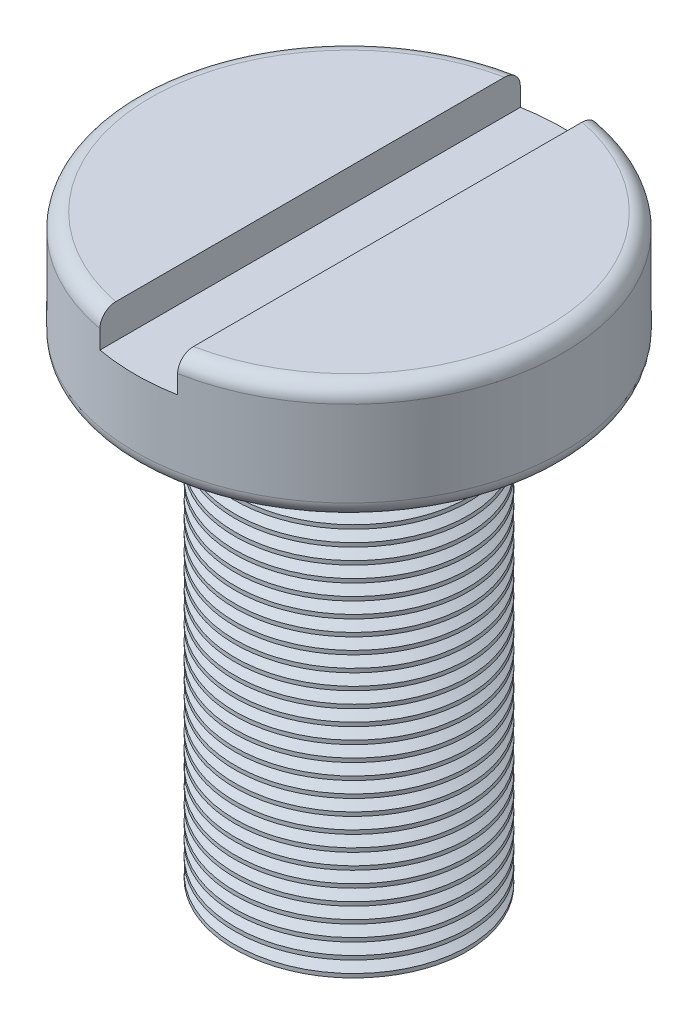
from build123d import *

# Parameters (mm, degrees)
SKETCH1_R           = 2.75
SKETCH1_R_2         = 1.5
BOSS_EXTRUDE1_DEPTH = 1.5
SKETCH1_3_R         = 1.5
BOSS_EXTRUDE2_DEPTH = 6
FILLET1_R           = 0.2
SKETCH3_W           = 7.35917601
SKETCH3_H           = 0.8748089
CUT_EXTRUDE1_DEPTH  = 0.5
CUT_SWEEP1_PITCH    = 0.2


with BuildPart() as part:
    # Sketch1 → Boss-Extrude1 (new body)
    # profile 1 of 2: a face of its own
    with BuildSketch(Plane(origin=(0, 0, 0), x_dir=(1, 0, 0), z_dir=(0, 1, 0))):
        with Locations(Location((0, 0, 0), (0, 0, 270))):
            Circle(SKETCH1_R)
        Circle(SKETCH1_R_2, mode=Mode.SUBTRACT)
    # profile 2 of 2: a face of its own
    with BuildSketch(Plane(origin=(0, 0, 0), x_dir=(1, 0, 0), z_dir=(0, 1, 0))):
        Circle(SKETCH1_R_2)
    extrude(amount=BOSS_EXTRUDE1_DEPTH)

    # Sketch1<3> → Boss-Extrude2 (add)
    with BuildSketch(Plane(origin=(0, 0, 0), x_dir=(1, 0, 0), z_dir=(0, 1, 0))):
        with Locations(Location((0, 0, 0), (0, 0, 270))):
            Circle(SKETCH1_3_R)
    extrude(amount=-BOSS_EXTRUDE2_DEPTH)

    # Fillet1
    fillet1_edges = [part.edges().sort_by_distance(p)[0] for p in [
        (0, 0, -2.75),
        (0, 1.5, -2.75),
    ]]
    fillet(fillet1_edges, radius=FILLET1_R)

    # Sketch3 → Cut-Extrude1 (cut, symmetric)
    with BuildSketch(Plane(origin=(0, 0, 0), x_dir=(0, 0, -1), z_dir=(1, 0, 0))):
        with Locations((0, 1.5)):
            Rectangle(SKETCH3_W, SKETCH3_H)
    extrude(amount=CUT_EXTRUDE1_DEPTH, both=True, mode=Mode.SUBTRACT)

    # Cut-Sweep1: arcs per turn and ends read off the stored shape
    # Cut-Sweep1: the profile of Sketch5 profile screwed along a left-hand helix through 30.5 turns, 6 arcs to a turn; built about Z, then put on its axis
    cut_sweep1_z = Axis((0, 0, 0), (0, 0, 1))
    cut_sweep1_corners = [(1.5003, 0, -0.025201576), (1.388379741, 0, 0.05), (1.5003, 0, 0.125201576)]
    with BuildLine(mode=Mode.PRIVATE) as cut_sweep1_profile:
        Line(cut_sweep1_corners[0], cut_sweep1_corners[1])
        Line(cut_sweep1_corners[1], cut_sweep1_corners[2])
        Line(cut_sweep1_corners[2], cut_sweep1_corners[0])
    cut_sweep1_cap = Face(cut_sweep1_profile.wire())
    cut_sweep1_turn_angles = [0, -30, -60, -90, -120, -150, -180, -210, -240, -270, -300, -330, -360]
    cut_sweep1_turn_weights = [1, 0.8660254037844387, 1, 0.8660254037844387, 1, 0.8660254037844387, 1, 0.8660254037844387, 1, 0.8660254037844387, 1, 0.8660254037844387, 1]
    cut_sweep1_turn_rails = [Edge.make_bspline([Vector(p[0], p[1], 0).rotate(cut_sweep1_z, cut_sweep1_turn_angles[k]) / cut_sweep1_turn_weights[k] + Vector(0, 0, p[2] + -CUT_SWEEP1_PITCH * cut_sweep1_turn_angles[k] / 360) for k in range(13)], [0, 0, 0, 1, 1, 2, 2, 3, 3, 4, 4, 5, 5, 6, 6, 6], 2, cut_sweep1_turn_weights) for p in cut_sweep1_corners]
    cut_sweep1_turn_sides = [Face.make_surface_from_curves(cut_sweep1_turn_rails[p[0]], cut_sweep1_turn_rails[p[1]]) for p in [(0, 1), (1, 2), (2, 0)]]
    cut_sweep1_last_angles = [-10800, -10830, -10860, -10890, -10920, -10950, -10980]
    cut_sweep1_last_weights = [1, 0.8660254037844387, 1, 0.8660254037844387, 1, 0.8660254037840815, 1]
    cut_sweep1_last_rails = [Edge.make_bspline([Vector(p[0], p[1], 0).rotate(cut_sweep1_z, cut_sweep1_last_angles[k]) / cut_sweep1_last_weights[k] + Vector(0, 0, p[2] + -CUT_SWEEP1_PITCH * cut_sweep1_last_angles[k] / 360) for k in range(7)], [0, 0, 0, 1, 1, 2, 2, 3, 3, 3], 2, cut_sweep1_last_weights) for p in cut_sweep1_corners]
    cut_sweep1_last_sides = [Face.make_surface_from_curves(cut_sweep1_last_rails[p[0]], cut_sweep1_last_rails[p[1]]) for p in [(0, 1), (1, 2), (2, 0)]]
    cut_sweep1 = Plane(origin=(0, 0, 0), x_dir=(0.7071067811865438, 0, 0.7071067811865513), z_dir=(0, -1, 0)) * Solid(Shell([*[p.moved(Location((0, 0, CUT_SWEEP1_PITCH * i))) for i in range(30) for p in cut_sweep1_turn_sides], *cut_sweep1_last_sides, cut_sweep1_cap, cut_sweep1_cap.rotate(cut_sweep1_z, -10980).moved(Location((0, 0, -CUT_SWEEP1_PITCH * -10980 / 360)))]))
    add(cut_sweep1, mode=Mode.SUBTRACT)


solid = part.part
